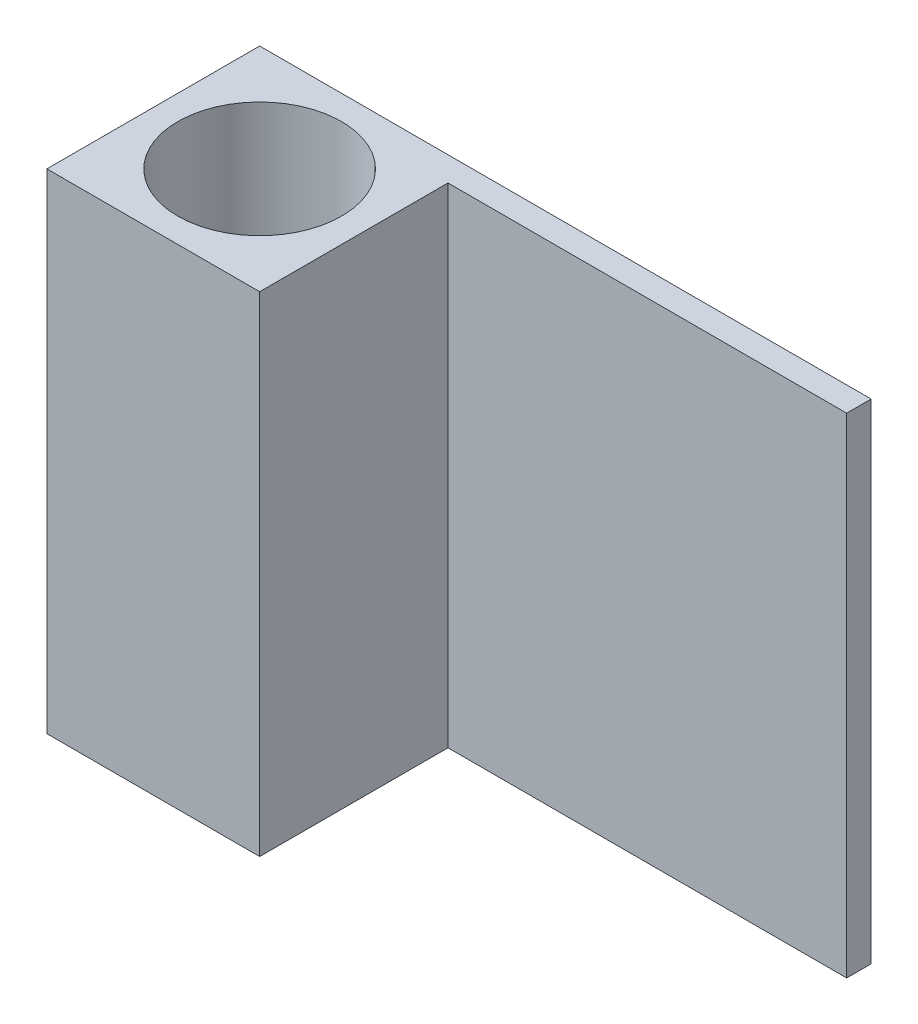
from build123d import *

# Parameters (mm, degrees)
SKETCH1_R           = 13.4
BOSS_EXTRUDE1_DEPTH = 80


with BuildPart() as part:
    # Sketch1 → Boss-Extrude1 (new body)
    with BuildSketch(Plane(origin=(0, 0, 0), x_dir=(1, 0, 0), z_dir=(0, 1, 0))):
        Polygon((-17.4, 17.4), (-17.4, -17.4), (17.4, -17.4), (17.4, 13.4), (82.6, 13.4), (82.6, 17.4), align=None)
        Circle(SKETCH1_R, mode=Mode.SUBTRACT)
    extrude(amount=BOSS_EXTRUDE1_DEPTH)


solid = part.part
